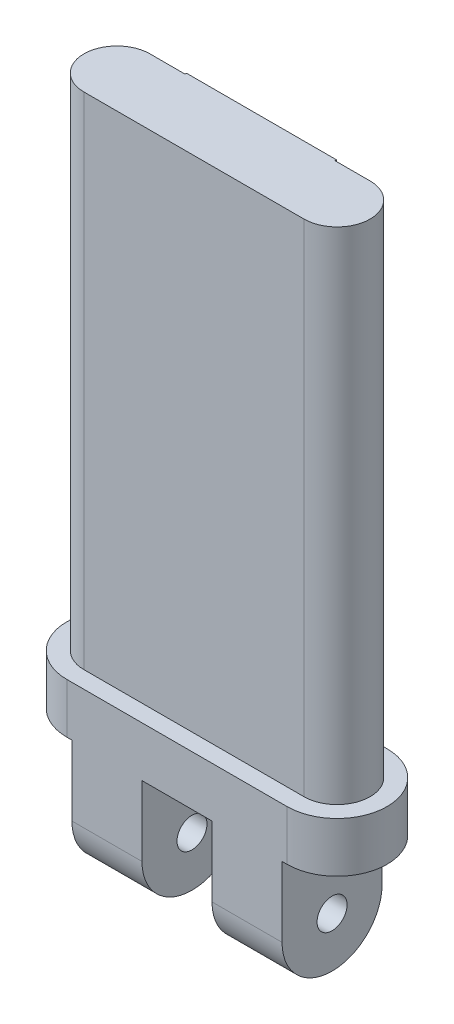
from build123d import *

# Parameters (mm, degrees)
EXTRUDE_1_DEPTH     = 50
SKETCH_2_W          = 15
SKETCH_2_H          = 1.5
CUT_EXTRUDE_1_DEPTH = 0.2
SKETCH_5_W          = 15
SKETCH_5_H          = 1.5
EXTRUDE_2_DEPTH     = 0.15
EXTRUDE_4_DEPTH     = 5
SKETCH_9_W          = 7
SKETCH_9_H          = 10
EXTRUDE_5_DEPTH     = 12
FILLET_2_R          = 5
SKETCH_10_R         = 1.5
CUT_EXTRUDE_3_DEPTH = 57.808890149
CUT_EXTRUDE_4_DEPTH = 15


with BuildPart() as part:
    # 草图1 → 凸台-拉伸1 (new body)
    with BuildSketch(Plane(origin=(0, 0, 0), x_dir=(1, 0, 0), z_dir=(0, 1, 0))):
        with BuildLine():
            Line((-11, 3.3), (11, 3.3))
            ThreePointArc((11, 3.3), (14.3, 0), (11, -3.3))
            Line((11, -3.3), (-11, -3.3))
            ThreePointArc((-11, -3.3), (-14.3, 0), (-11, 3.3))
        make_face()
    extrude(amount=EXTRUDE_1_DEPTH)

    # 草图2 → 切除-拉伸1 (cut)
    with BuildSketch(Plane(origin=(0, 0, -3.3), x_dir=(-1, 0, 0), z_dir=(0, 0, -1))):
        with Locations((0, 37.5)):
            Rectangle(SKETCH_2_W, SKETCH_2_H)
        with Locations((0, 12.5)):
            Rectangle(SKETCH_2_W, SKETCH_2_H)
        with Locations((0, 25)):
            Rectangle(SKETCH_2_W, SKETCH_2_H)
    extrude(amount=-CUT_EXTRUDE_1_DEPTH, mode=Mode.SUBTRACT)

    # 草图5 → 凸台-拉伸2 (add)
    with BuildSketch(Plane(origin=(0, 0, -3.3), x_dir=(-1, 0, 0), z_dir=(0, 0, -1))):
        with Locations((0, 49.25)):
            Rectangle(SKETCH_5_W, SKETCH_5_H)
    extrude(amount=EXTRUDE_2_DEPTH)

    # 草图8 → 凸台-拉伸4 (add)
    with BuildSketch(Plane.XZ):
        with BuildLine():
            Line((-11, -5), (11, -5))
            ThreePointArc((11, -5), (16, 0), (11, 5))
            Line((11, 5), (-11, 5))
            ThreePointArc((-11, 5), (-16, 0), (-11, -5))
        make_face()
    extrude(amount=EXTRUDE_4_DEPTH)

    # 草图9 → 凸台-拉伸5 (add)
    with BuildSketch(Plane.XZ.offset(5)):
        with Locations((-7, 0)):
            Rectangle(SKETCH_9_W, SKETCH_9_H)
        with Locations((7, 0)):
            Rectangle(SKETCH_9_W, SKETCH_9_H)
    extrude(amount=EXTRUDE_5_DEPTH)

    # 圆角2
    fillet_2_edges = [part.edges().sort_by_distance(p)[0] for p in [
        (7, -17, 5),
        (7, -17, -5),
        (-7, -17, 5),
        (-7, -17, -5),
    ]]
    fillet(fillet_2_edges, radius=FILLET_2_R - 0.0001)  # a hair under: the kernel refuses the full size

    # 草图10 → 切除-拉伸3 (cut, through all)
    with BuildSketch(Plane(origin=(10.5, 0, 0), x_dir=(0, 0, -1), z_dir=(1, 0, 0))):
        with Locations((0, -12)):
            Circle(SKETCH_10_R)
    extrude(amount=-CUT_EXTRUDE_3_DEPTH, mode=Mode.SUBTRACT)

    # 草图11 → 切除-拉伸4 (cut)
    with BuildSketch(Plane(origin=(-7.5, 0, 0), x_dir=(0, 0, -1), z_dir=(1, 0, 0))):
        with BuildLine():
            Line((3.3, 38.45), (3.3, 38.25))
            Line((3.3, 38.25), (3.1, 38.25))
            ThreePointArc((3.1, 38.25), (3.158578644, 38.391421356), (3.3, 38.45))
        make_face()
        with BuildLine():
            Line((3.3, 36.75), (3.3, 36.55))
            ThreePointArc((3.3, 36.55), (3.158578644, 36.608578644), (3.1, 36.75))
            Line((3.1, 36.75), (3.3, 36.75))
        make_face()
        with BuildLine():
            Line((3.3, 25.95), (3.3, 25.75))
            Line((3.3, 25.75), (3.1, 25.75))
            ThreePointArc((3.1, 25.75), (3.158578644, 25.891421356), (3.3, 25.95))
        make_face()
        with BuildLine():
            Line((3.3, 13.45), (3.3, 13.25))
            Line((3.3, 13.25), (3.1, 13.25))
            ThreePointArc((3.1, 13.25), (3.158578644, 13.391421356), (3.3, 13.45))
        make_face()
        with BuildLine():
            Line((3.3, 24.25), (3.3, 24.05))
            ThreePointArc((3.3, 24.05), (3.158578644, 24.108578644), (3.1, 24.25))
            Line((3.1, 24.25), (3.3, 24.25))
        make_face()
        with BuildLine():
            Line((3.3, 11.75), (3.3, 11.55))
            ThreePointArc((3.3, 11.55), (3.158578644, 11.608578644), (3.1, 11.75))
            Line((3.1, 11.75), (3.3, 11.75))
        make_face()
    extrude(amount=CUT_EXTRUDE_4_DEPTH, mode=Mode.SUBTRACT)


solid = part.part
